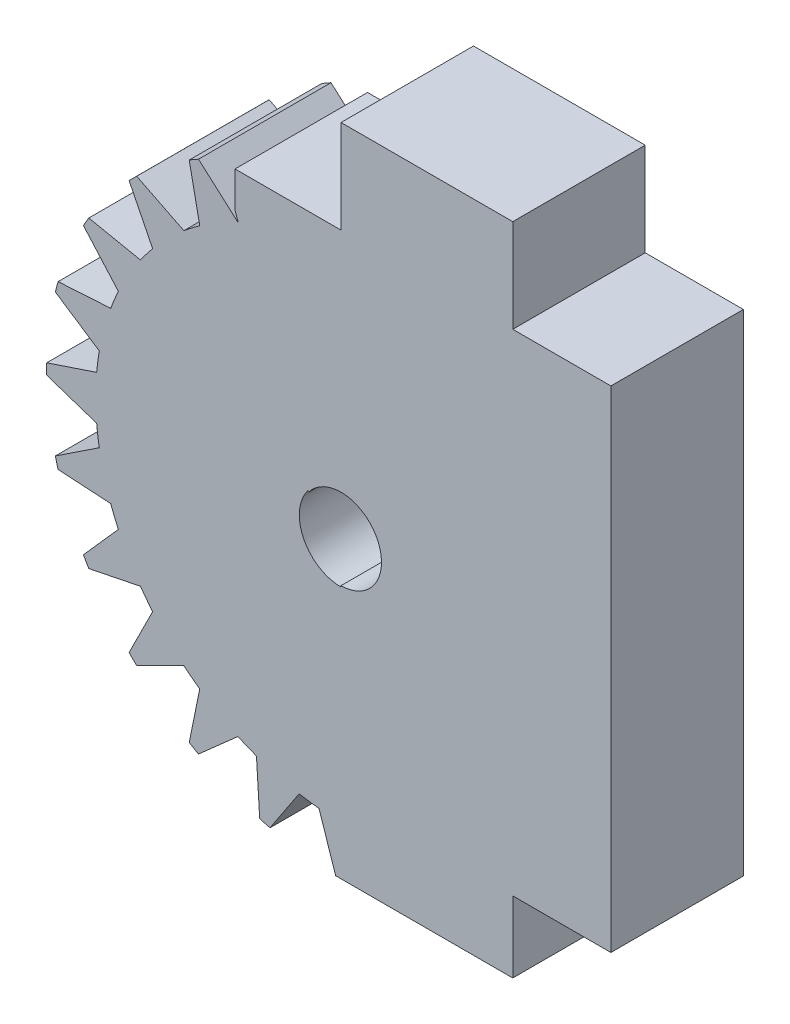
from build123d import *

# Parameters (mm, degrees)
SKETCH1_R           = 10
BOSS_EXTRUDE1_DEPTH = 5.4
BOSS_EXTRUDE2_DEPTH = 5.4
CIRPATTERN1_COUNT   = 24
SKETCH3_R           = 12.65
SKETCH3_R_2         = 12
CUT_EXTRUDE1_DEPTH  = 6
CUT_EXTRUDE2_DEPTH  = 6
SKETCH5_R           = 1.7
CUT_EXTRUDE3_DEPTH  = 6
BOSS_EXTRUDE3_DEPTH = 5.4


with BuildPart() as part:
    # Sketch1 → Boss-Extrude1 (new body)
    with BuildSketch(Plane.XY):
        Circle(SKETCH1_R)
    extrude(amount=BOSS_EXTRUDE1_DEPTH)

    # Sketch2 → Boss-Extrude2 (add)
    with BuildSketch(Plane.XY):
        with BuildLine():
            Line((0, 12.65), (-0.9, 9.959417654))
            ThreePointArc((-0.9, 9.959417654), (0, 10), (0.9, 9.959417654))
            Line((0.9, 9.959417654), (0, 12.65))
        make_face()
    boss_extrude2 = extrude(amount=BOSS_EXTRUDE2_DEPTH)

    # CirPattern1: Boss-Extrude2 ×24 about axis
    cirpattern1_axis = Axis((0, 0, 5.4), (0, 0, 1))
    for i in range(1, CIRPATTERN1_COUNT):
        add(boss_extrude2.rotate(cirpattern1_axis, i * 360 / CIRPATTERN1_COUNT))

    # Sketch3 → Cut-Extrude1 (cut)
    with BuildSketch(Plane.XY):
        Circle(SKETCH3_R)
        Circle(SKETCH3_R_2, mode=Mode.SUBTRACT)
    extrude(amount=CUT_EXTRUDE1_DEPTH, mode=Mode.SUBTRACT)

    # Sketch4 → Cut-Extrude2 (cut)
    with BuildSketch(Plane.XY):
        with BuildLine():
            Line((0, 0), (0, -12))
            ThreePointArc((0, -12), (11.769423365, 2.341083864), (-4.592201188, 11.08655439))
            Line((-4.592201188, 11.08655439), (-3.826834324, 9.238795325))
            Line((-3.826834324, 9.238795325), (0, 0))
        make_face()
    extrude(amount=CUT_EXTRUDE2_DEPTH, mode=Mode.SUBTRACT)

    # Sketch5 → Cut-Extrude3 (cut)
    with BuildSketch(Plane.XY):
        Circle(SKETCH5_R)
    extrude(amount=CUT_EXTRUDE3_DEPTH, mode=Mode.SUBTRACT)

    # Sketch6 → Boss-Extrude3 (add)
    with BuildSketch(Plane.XY):
        with BuildLine():
            Line((-4.32, 9.438795325), (-4.32, 10.9))
            Line((-4.32, 10.9), (0, 10.9))
            Line((0, 10.9), (0, 14.7))
            Line((0, 14.7), (7, 14.7))
            Line((7, 14.7), (7, 10.9))
            Line((7, 10.9), (11, 10.9))
            Line((11, 10.9), (11, -9.1))
            Line((11, -9.1), (7, -9.1))
            Line((7, -9.1), (7, -12))
            Line((7, -12), (0, -12))
            Line((0, -12), (0, -1.65))
            ThreePointArc((0, -1.65), (1.472580529, 0.744316187), (-1.328564272, 0.978476865))
            Line((-1.328564272, 0.978476865), (-4.32, 9.438795325))
        make_face()
    extrude(amount=BOSS_EXTRUDE3_DEPTH)


solid = part.part
